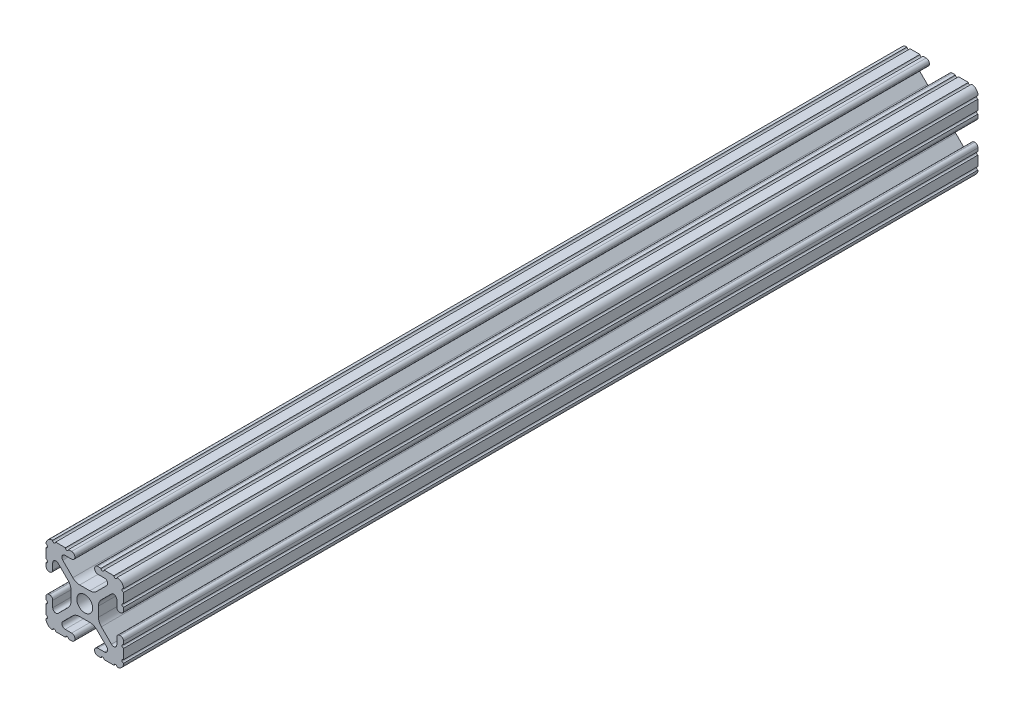
from build123d import *

# Parameters (mm, degrees)
SKETCH1_R      = 2.6035
EXTRUDE1_DEPTH = 140


with BuildPart() as part:
    # Sketch1 → Extrude1 (new, symmetric)
    with BuildSketch(Plane.XY):
        with BuildLine():
            Line((-7.207036008, 8.724370562), (-3.898272566, 5.423169045))
            ThreePointArc((-3.898272566, 5.423169045), (-2.869120213, 4.736787962), (-1.655778399, 4.4958))
            Line((-1.655778399, 4.4958), (1.655778399, 4.4958))
            ThreePointArc((1.655778399, 4.4958), (2.869120213, 4.736787962), (3.898272566, 5.423169045))
            Line((3.898272566, 5.423169045), (7.207036008, 8.724370562))
            ThreePointArc((7.207036008, 8.724370562), (7.432222385, 9.85140422), (6.476788598, 10.4902))
            Line((6.476788598, 10.4902), (4.287512407, 10.4902))
            ThreePointArc((4.287512407, 10.4902), (3.54574862, 10.79744862), (3.2385, 11.539212407))
            Line((3.2385, 11.539212407), (3.2385, 11.650987593))
            ThreePointArc((3.2385, 11.650987593), (3.54574862, 12.39275138), (4.287512407, 12.7))
            Line((4.287512407, 12.7), (5.317126718, 12.7))
            ThreePointArc((5.317126718, 12.7), (5.825126718, 12.192), (6.333126718, 12.7))
            Line((6.333126718, 12.7), (9.550443118, 12.7))
            ThreePointArc((9.550443118, 12.7), (10.058366869, 12.192000006), (10.566443095, 12.699847501))
            ThreePointArc((10.566443095, 12.699847501), (12.082537762, 12.08250727), (12.699846982, 10.566399977))
            ThreePointArc((12.699846982, 10.566399977), (12.192000006, 10.058323491), (12.7, 9.5504))
            Line((12.7, 9.5504), (12.7, 6.3330836))
            ThreePointArc((12.7, 6.3330836), (12.192, 5.8250836), (12.7, 5.3170836))
            Line((12.7, 5.3170836), (12.7, 4.287469289))
            ThreePointArc((12.7, 4.287469289), (12.39275138, 3.545705502), (11.650987593, 3.238456882))
            Line((11.650987593, 3.238456882), (11.539212407, 3.238456882))
            ThreePointArc((11.539212407, 3.238456882), (10.79744862, 3.545705502), (10.4902, 4.287469289))
            Line((10.4902, 4.287469289), (10.4902, 6.402089023))
            ThreePointArc((10.4902, 6.402089023), (9.856505071, 7.351067942), (8.737131347, 7.129408934))
            Line((8.737131347, 7.129408934), (5.441005833, 3.840816462))
            ThreePointArc((5.441005833, 3.840816462), (4.750877967, 2.809883091), (4.5085, 1.593185507))
            Line((4.5085, 1.593185507), (4.5085, -1.593185507))
            ThreePointArc((4.5085, -1.593185507), (4.750877967, -2.809883091), (5.441005833, -3.840816462))
            Line((5.441005833, -3.840816462), (8.737131347, -7.129408934))
            ThreePointArc((8.737131347, -7.129408934), (9.856505071, -7.351067942), (10.4902, -6.402089023))
            Line((10.4902, -6.402089023), (10.4902, -4.287469289))
            ThreePointArc((10.4902, -4.287469289), (10.79744862, -3.545705502), (11.539212407, -3.238456882))
            Line((11.539212407, -3.238456882), (11.650987593, -3.238456882))
            ThreePointArc((11.650987593, -3.238456882), (12.39275138, -3.545705502), (12.7, -4.287469289))
            Line((12.7, -4.287469289), (12.7, -5.3170836))
            ThreePointArc((12.7, -5.3170836), (12.192, -5.8250836), (12.7, -6.3330836))
            Line((12.7, -6.3330836), (12.7, -9.5504))
            ThreePointArc((12.7, -9.5504), (12.192000006, -10.058323491), (12.699846982, -10.566399977))
            ThreePointArc((12.699846982, -10.566399977), (12.082537762, -12.08250727), (10.566443095, -12.699847501))
            ThreePointArc((10.566443095, -12.699847501), (10.058366869, -12.192000006), (9.550443118, -12.7))
            Line((9.550443118, -12.7), (6.333126718, -12.7))
            ThreePointArc((6.333126718, -12.7), (5.825126718, -12.192), (5.317126718, -12.7))
            Line((5.317126718, -12.7), (4.287512407, -12.7))
            ThreePointArc((4.287512407, -12.7), (3.54574862, -12.39275138), (3.2385, -11.650987593))
            Line((3.2385, -11.650987593), (3.2385, -11.539212407))
            ThreePointArc((3.2385, -11.539212407), (3.54574862, -10.79744862), (4.287512407, -10.4902))
            Line((4.287512407, -10.4902), (6.416408329, -10.4902))
            ThreePointArc((6.416408329, -10.4902), (7.41473083, -9.822813117), (7.179650497, -8.645192506))
            Line((7.179650497, -8.645192506), (3.952270251, -5.423690499))
            ThreePointArc((3.952270251, -5.423690499), (2.922936451, -4.736929036), (1.709253557, -4.4958))
            Line((1.709253557, -4.4958), (-1.709253557, -4.4958))
            ThreePointArc((-1.709253557, -4.4958), (-2.922936451, -4.736929036), (-3.952270251, -5.423690499))
            Line((-3.952270251, -5.423690499), (-7.179650497, -8.645192506))
            ThreePointArc((-7.179650497, -8.645192506), (-7.41473083, -9.822813117), (-6.416408329, -10.4902))
            Line((-6.416408329, -10.4902), (-4.287512407, -10.4902))
            ThreePointArc((-4.287512407, -10.4902), (-3.54574862, -10.79744862), (-3.2385, -11.539212407))
            Line((-3.2385, -11.539212407), (-3.2385, -11.650987593))
            ThreePointArc((-3.2385, -11.650987593), (-3.54574862, -12.39275138), (-4.287512407, -12.7))
            Line((-4.287512407, -12.7), (-5.317126718, -12.7))
            ThreePointArc((-5.317126718, -12.7), (-5.825126718, -12.192), (-6.333126718, -12.7))
            Line((-6.333126718, -12.7), (-9.550443118, -12.7))
            ThreePointArc((-9.550443118, -12.7), (-10.058366869, -12.192000006), (-10.566443095, -12.699847501))
            ThreePointArc((-10.566443095, -12.699847501), (-12.082537762, -12.08250727), (-12.699846982, -10.566399977))
            ThreePointArc((-12.699846982, -10.566399977), (-12.192000006, -10.058323491), (-12.7, -9.5504))
            Line((-12.7, -9.5504), (-12.7, -6.3330836))
            ThreePointArc((-12.7, -6.3330836), (-12.192, -5.8250836), (-12.7, -5.3170836))
            Line((-12.7, -5.3170836), (-12.7, -4.287469289))
            ThreePointArc((-12.7, -4.287469289), (-12.39275138, -3.545705502), (-11.650987593, -3.238456882))
            Line((-11.650987593, -3.238456882), (-11.539212407, -3.238456882))
            ThreePointArc((-11.539212407, -3.238456882), (-10.79744862, -3.545705502), (-10.4902, -4.287469289))
            Line((-10.4902, -4.287469289), (-10.4902, -6.402089023))
            ThreePointArc((-10.4902, -6.402089023), (-9.856505071, -7.351067942), (-8.737131347, -7.129408934))
            Line((-8.737131347, -7.129408934), (-5.441005833, -3.840816462))
            ThreePointArc((-5.441005833, -3.840816462), (-4.750877967, -2.809883091), (-4.5085, -1.593185507))
            Line((-4.5085, -1.593185507), (-4.5085, 1.593185507))
            ThreePointArc((-4.5085, 1.593185507), (-4.750877967, 2.809883091), (-5.441005833, 3.840816462))
            Line((-5.441005833, 3.840816462), (-8.737131347, 7.129408934))
            ThreePointArc((-8.737131347, 7.129408934), (-9.856505071, 7.351067942), (-10.4902, 6.402089023))
            Line((-10.4902, 6.402089023), (-10.4902, 4.287469289))
            ThreePointArc((-10.4902, 4.287469289), (-10.79744862, 3.545705502), (-11.539212407, 3.238456882))
            Line((-11.539212407, 3.238456882), (-11.650987593, 3.238456882))
            ThreePointArc((-11.650987593, 3.238456882), (-12.39275138, 3.545705502), (-12.7, 4.287469289))
            Line((-12.7, 4.287469289), (-12.7, 5.3170836))
            ThreePointArc((-12.7, 5.3170836), (-12.192, 5.8250836), (-12.7, 6.3330836))
            Line((-12.7, 6.3330836), (-12.7, 9.5504))
            ThreePointArc((-12.7, 9.5504), (-12.192000006, 10.058323491), (-12.699846982, 10.566399977))
            ThreePointArc((-12.699846982, 10.566399977), (-12.082537762, 12.08250727), (-10.566443095, 12.699847501))
            ThreePointArc((-10.566443095, 12.699847501), (-10.058366869, 12.192000006), (-9.550443118, 12.7))
            Line((-9.550443118, 12.7), (-6.333126718, 12.7))
            ThreePointArc((-6.333126718, 12.7), (-5.825126718, 12.192), (-5.317126718, 12.7))
            Line((-5.317126718, 12.7), (-4.287512407, 12.7))
            ThreePointArc((-4.287512407, 12.7), (-3.54574862, 12.39275138), (-3.2385, 11.650987593))
            Line((-3.2385, 11.650987593), (-3.2385, 11.539212407))
            ThreePointArc((-3.2385, 11.539212407), (-3.54574862, 10.79744862), (-4.287512407, 10.4902))
            Line((-4.287512407, 10.4902), (-6.476788598, 10.4902))
            ThreePointArc((-6.476788598, 10.4902), (-7.432222385, 9.85140422), (-7.207036008, 8.724370562))
        make_face()
        Circle(SKETCH1_R, mode=Mode.SUBTRACT)
    extrude(amount=EXTRUDE1_DEPTH, both=True)


solid = part.part
